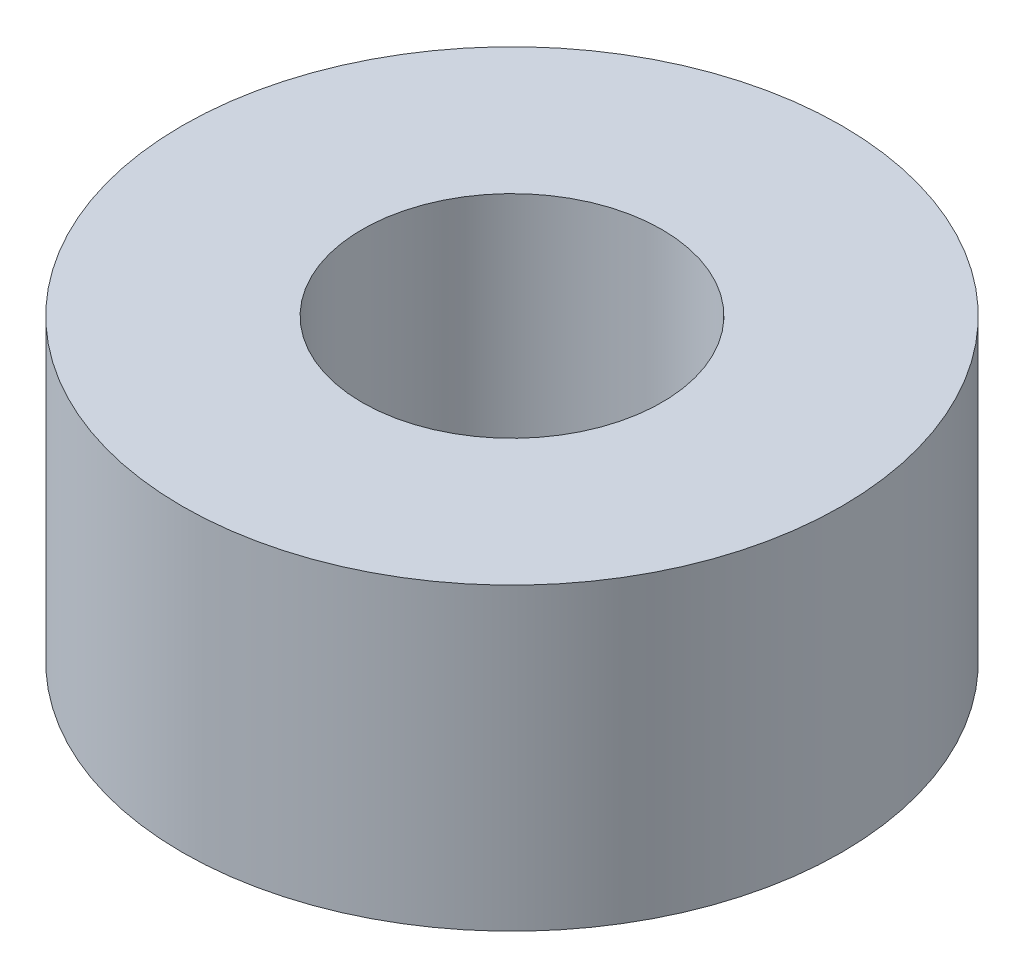
from build123d import *

# Parameters (mm, degrees)
SKETCH_1_R      = 5.5
SKETCH_1_R_2    = 2.5
EXTRUDE_1_DEPTH = 5


with BuildPart() as part:
    # 草图1 → 凸台-拉伸1 (new body)
    with BuildSketch(Plane(origin=(0, 0, 0), x_dir=(1, 0, 0), z_dir=(0, 1, 0))):
        Circle(SKETCH_1_R)
        Circle(SKETCH_1_R_2, mode=Mode.SUBTRACT)
    extrude(amount=EXTRUDE_1_DEPTH)


solid = part.part
